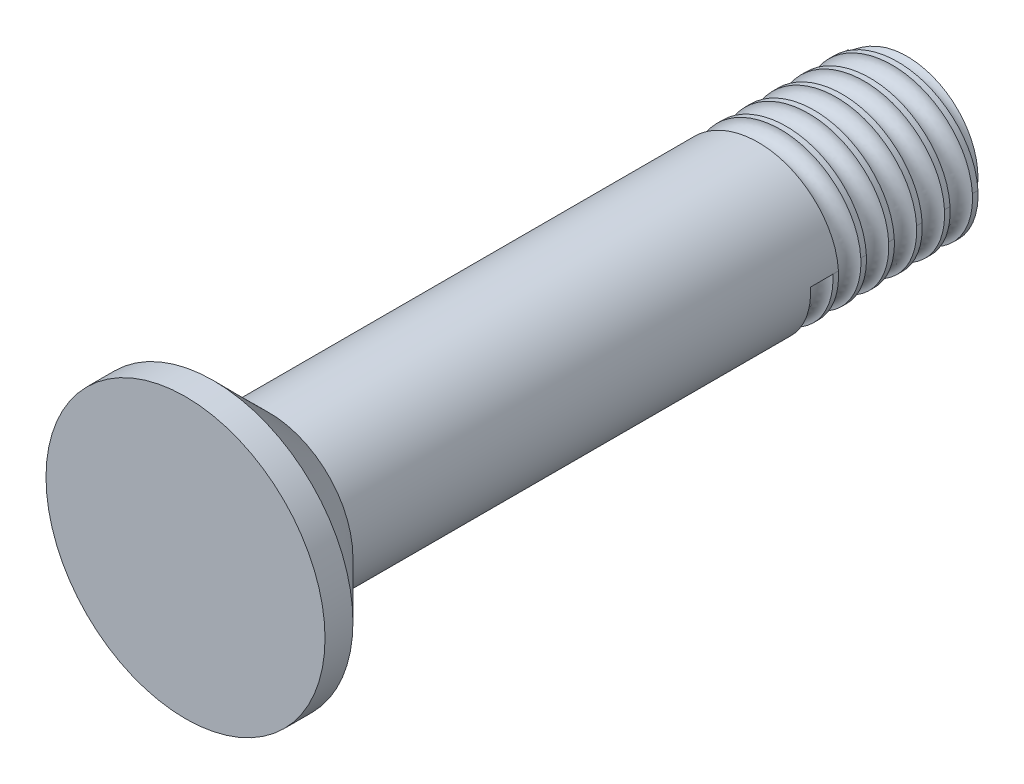
from build123d import *

# Parameters (mm, degrees)
SKETCH1_R        = 1.4
EXTRUDE1_DEPTH   = 13
SKETCH3_R        = 2.5
EXTRUDE2_DEPTH   = 1.5
CUT_SWEEP1_PITCH = 0.5
CHAMFER1_SIZE    = 1


with BuildPart() as part:
    # Sketch1 → Extrude1 (new body)
    with BuildSketch(Plane.XY):
        with Locations(Location((0, 0, 0), (0, 0, 180))):
            Circle(SKETCH1_R)
    extrude(amount=EXTRUDE1_DEPTH)

    # Sketch3 → Extrude2 (add)
    with BuildSketch(Plane.XY.offset(13)):
        Circle(SKETCH3_R)
    extrude(amount=-EXTRUDE2_DEPTH)

    # Cut-Sweep1: arcs per turn and ends read off the stored shape
    # Cut-Sweep1: the profile of Sketch5 screwed along a right-hand helix through 7 turns, 6 arcs to a turn; built about Z, then put on its axis
    cut_sweep1_z = Axis((0, 0, 0), (0, 0, 1))
    cut_sweep1_corners = [(1.6, 0, -0.5), (1.4, 0, -0.7), (1.2, 0, -0.5), (1.4, 0, -0.3)]
    with BuildLine(mode=Mode.PRIVATE) as cut_sweep1_profile:
        ThreePointArc((1.6, 0, -0.5), (1.541421356, 0, -0.641421356), (1.4, 0, -0.7))
        ThreePointArc((1.4, 0, -0.7), (1.258578644, 0, -0.641421356), (1.2, 0, -0.5))
        ThreePointArc((1.2, 0, -0.5), (1.258578644, 0, -0.358578644), (1.4, 0, -0.3))
        ThreePointArc((1.4, 0, -0.3), (1.541421356, 0, -0.358578644), (1.6, 0, -0.5))
    cut_sweep1_cap = Face(cut_sweep1_profile.wire())
    cut_sweep1_arcs = [((1.6, 0, -0.5), (1.6, 0, -0.7), (1.4, 0, -0.7), (1, 0.7071067811865476, 1)), ((1.4, 0, -0.7), (1.2, 0, -0.7), (1.2, 0, -0.5), (1, 0.7071067811865476, 1)), ((1.2, 0, -0.5), (1.2, 0, -0.3), (1.4, 0, -0.3), (1, 0.7071067811865476, 1)), ((1.4, 0, -0.3), (1.6, 0, -0.3), (1.6, 0, -0.5), (1, 0.7071067811865476, 1))]  # start, shoulder, end, weights
    cut_sweep1_turn_angles = [0, 30, 60, 90, 120, 150, 180, 210, 240, 270, 300, 330, 360]
    cut_sweep1_turn_weights = [1, 0.8660254037844387, 1, 0.8660254037844387, 1, 0.8660254037844387, 1, 0.8660254037844387, 1, 0.8660254037844387, 1, 0.8660254037844387, 1]
    cut_sweep1_turn_sides = [Face.make_bezier_surface([[Vector(p[j][0], p[j][1], 0).rotate(cut_sweep1_z, cut_sweep1_turn_angles[2 * i + k]) / cut_sweep1_turn_weights[2 * i + k] + Vector(0, 0, p[j][2] + CUT_SWEEP1_PITCH * cut_sweep1_turn_angles[2 * i + k] / 360) for k in range(3)] for j in range(3)], [[p[3][j] * cut_sweep1_turn_weights[2 * i + k] for k in range(3)] for j in range(3)]) for p in cut_sweep1_arcs for i in range(6)]
    cut_sweep1 = Plane(origin=(0, 0, 0), x_dir=(1, 0, 0), z_dir=(0, 0, 1)) * Solid(Shell([*[p.moved(Location((0, 0, CUT_SWEEP1_PITCH * i))) for i in range(7) for p in cut_sweep1_turn_sides], cut_sweep1_cap, cut_sweep1_cap.rotate(cut_sweep1_z, 2520).moved(Location((0, 0, CUT_SWEEP1_PITCH * 2520 / 360)))]))
    add(cut_sweep1, mode=Mode.SUBTRACT)

    # Chamfer1
    chamfer1_edges = [part.edges().sort_by_distance(p)[0] for p in [
        (-2.5, 0, 11.5),
    ]]
    chamfer(chamfer1_edges, length=CHAMFER1_SIZE)


solid = part.part
